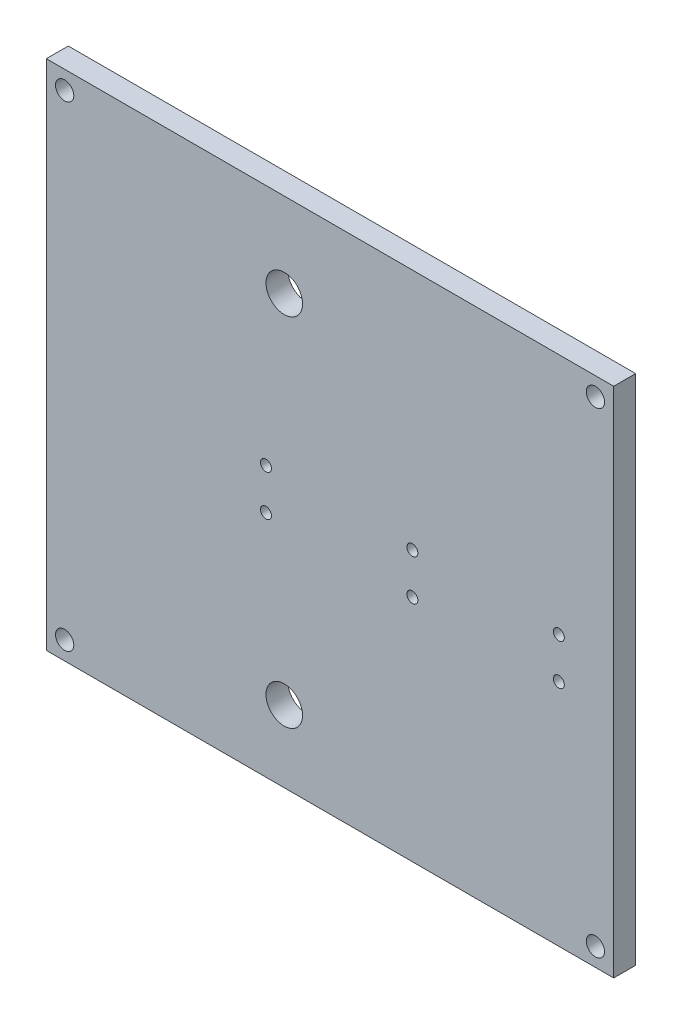
from build123d import *

# Parameters (mm, degrees)
ESQUISSE1_W             = 155
ESQUISSE1_H             = 140
ESQUISSE1_R             = 5
ESQUISSE1_R_2           = 2.5
BOSS_EXTRU_1_DEPTH      = 6
ESQUISSE6_R             = 1.5
ENL_V_MAT_EXTRU_1_DEPTH = 6


with BuildPart() as part:
    # Esquisse1 → Boss.-Extru.1 (new body)
    with BuildSketch(Plane.XY):
        with Locations((0, 5.5)):
            Rectangle(ESQUISSE1_W, ESQUISSE1_H)
        with Locations((-12.5, -44.9)):
            Circle(ESQUISSE1_R, mode=Mode.SUBTRACT)
        with Locations((-12.5, 52.46)):
            Circle(ESQUISSE1_R, mode=Mode.SUBTRACT)
        with Locations((-72.5, -59.5)):
            Circle(ESQUISSE1_R_2, mode=Mode.SUBTRACT)
        with Locations((-72.5, 70.5)):
            Circle(ESQUISSE1_R_2, mode=Mode.SUBTRACT)
        with Locations((72.5, -59.5)):
            Circle(ESQUISSE1_R_2, mode=Mode.SUBTRACT)
        with Locations((72.5, 70.5)):
            Circle(ESQUISSE1_R_2, mode=Mode.SUBTRACT)
    extrude(amount=BOSS_EXTRU_1_DEPTH)

    # Esquisse6 → Enlèv. mat.-Extru.1 (cut)
    with BuildSketch(Plane.XY.offset(6)):
        with Locations((-17.5, 9.26)):
            Circle(ESQUISSE6_R)
        with Locations((22.5, 9.26)):
            Circle(ESQUISSE6_R)
        with Locations((62.5, 9.26)):
            Circle(ESQUISSE6_R)
        with Locations((62.5, -1.9)):
            Circle(ESQUISSE6_R)
        with Locations((22.5, -1.9)):
            Circle(ESQUISSE6_R)
        with Locations((-17.5, -1.9)):
            Circle(ESQUISSE6_R)
    extrude(amount=-ENL_V_MAT_EXTRU_1_DEPTH, mode=Mode.SUBTRACT)


solid = part.part
